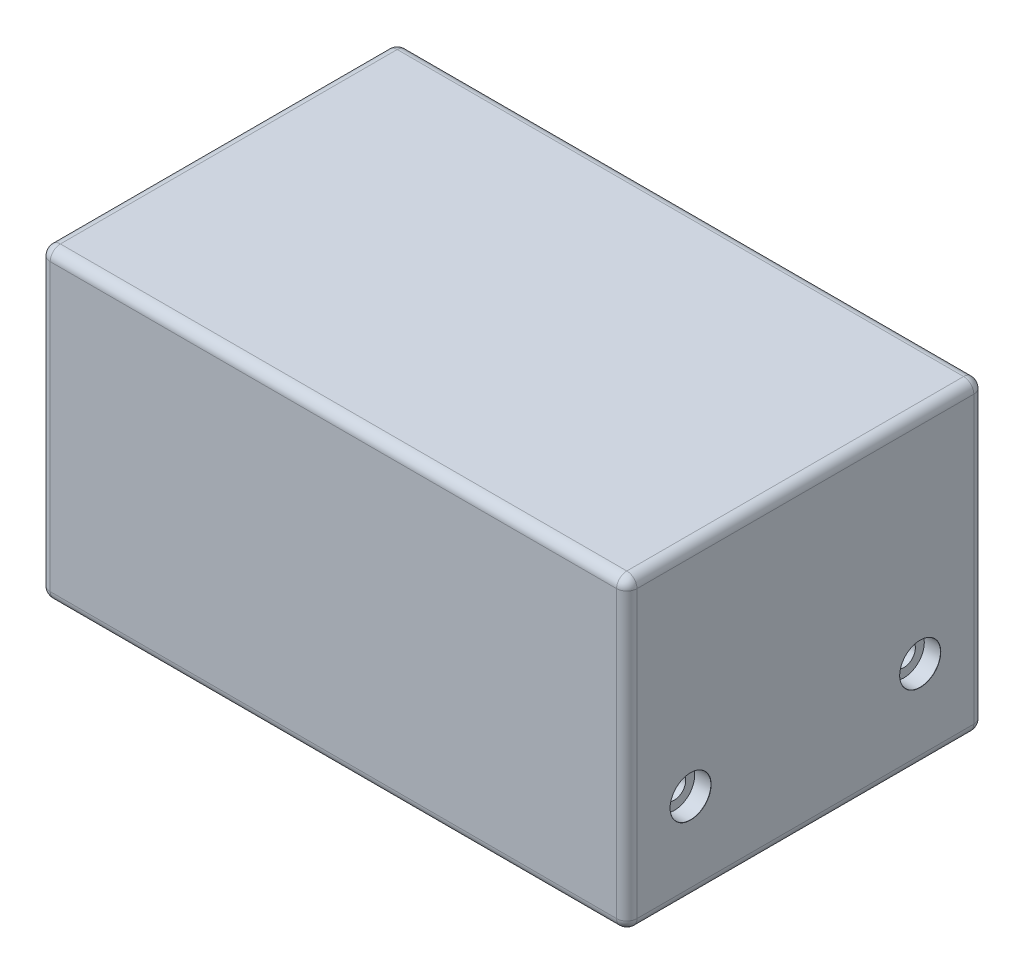
from build123d import *

# Parameters (mm, degrees)
CROQUIS1_W                                  = 115
CROQUIS1_H                                  = 70
SALIENTE_EXTRUIR1_DEPTH                     = 5
SALIENTE_EXTRUIR2_DEPTH                     = 55
CROQUIS3_W                                  = 60
CROQUIS3_H                                  = 5
SALIENTE_EXTRUIR3_DEPTH                     = 110
CROQUIS4_W                                  = 15
CROQUIS4_H                                  = 15
SALIENTE_EXTRUIR4_DEPTH                     = 5
REFRENTADO_PARA_TORNILLO_CON_CABEZA_2_COUNT = 2
REFRENTADO_PARA_TORNILLO_CON_CABEZA_2_PITCH = 45
REDONDEO1_R                                 = 2


with BuildPart() as part:
    # Croquis1 → Saliente-Extruir1 (new body)
    with BuildSketch(Plane(origin=(0, 0, 0), x_dir=(1, 0, 0), z_dir=(0, 1, 0))):
        with Locations((57.5, 35)):
            Rectangle(CROQUIS1_W, CROQUIS1_H)
    extrude(amount=SALIENTE_EXTRUIR1_DEPTH)

    # Croquis2 → Saliente-Extruir2 (add)
    with BuildSketch(Plane(origin=(0, 5, 0), x_dir=(1, 0, 0), z_dir=(0, 1, 0))):
        Polygon((0, 0), (115, 0), (115, 70), (0, 70), (0, 65), (110, 65), (110, 5), (0, 5), align=None)
    extrude(amount=SALIENTE_EXTRUIR2_DEPTH)

    # Croquis3 → Saliente-Extruir3 (add)
    with BuildSketch(Plane.ZY.offset(-110)):
        with Locations((-35, 57.5)):
            Rectangle(CROQUIS3_W, CROQUIS3_H)
    extrude(amount=SALIENTE_EXTRUIR3_DEPTH)

    # Croquis4 → Saliente-Extruir4 (add)
    with BuildSketch(Plane.ZY.offset(-110)):
        with Locations((-57.5, 17.5)):
            Rectangle(CROQUIS4_W, CROQUIS4_H)
        with Locations((-12.5, 17.5)):
            Rectangle(CROQUIS4_W, CROQUIS4_H)
    extrude(amount=SALIENTE_EXTRUIR4_DEPTH)

    # Croquis7 → Refrentado para tornillo con cabeza hueca de M41 (revolve, cut)
    with BuildSketch(Plane(origin=(115, 17.5, -12.5), x_dir=(0, 0, -1), z_dir=(0, 1, 0))):
        Polygon((0, 0), (0, 21.851936393), (2.25, 20.5), (2.25, 3.2), (4, 3.2), (4, 0.025), (4.025, 0), align=None)
    refrentado_para_tornillo_con_cabeza_huec = revolve(axis=Axis((121.35, 17.5, -12.5), (-1, 0, 0)), mode=Mode.SUBTRACT)

    # Refrentado para tornillo con cabeza  2: Refrentado para tornillo con cabeza hueca de M41 ×2
    with Locations(*[(0, 0, -i * REFRENTADO_PARA_TORNILLO_CON_CABEZA_2_PITCH) for i in range(1, REFRENTADO_PARA_TORNILLO_CON_CABEZA_2_COUNT)]):
        add(refrentado_para_tornillo_con_cabeza_huec, mode=Mode.SUBTRACT)

    # Redondeo1
    redondeo1_edges = [part.edges().sort_by_distance(p)[0] for p in [
        (57.5, 0, 0),
        (115, 0, -35),
        (0, 0, -35),
        (57.5, 0, -70),
        (115, 30, -70),
        (115, 60, -35),
        (115, 30, 0),
        (57.5, 60, 0),
        (0, 30, 0),
        (0, 60, -35),
        (0, 30, -70),
        (57.5, 60, -70),
    ]]
    fillet(redondeo1_edges, radius=REDONDEO1_R)


solid = part.part
